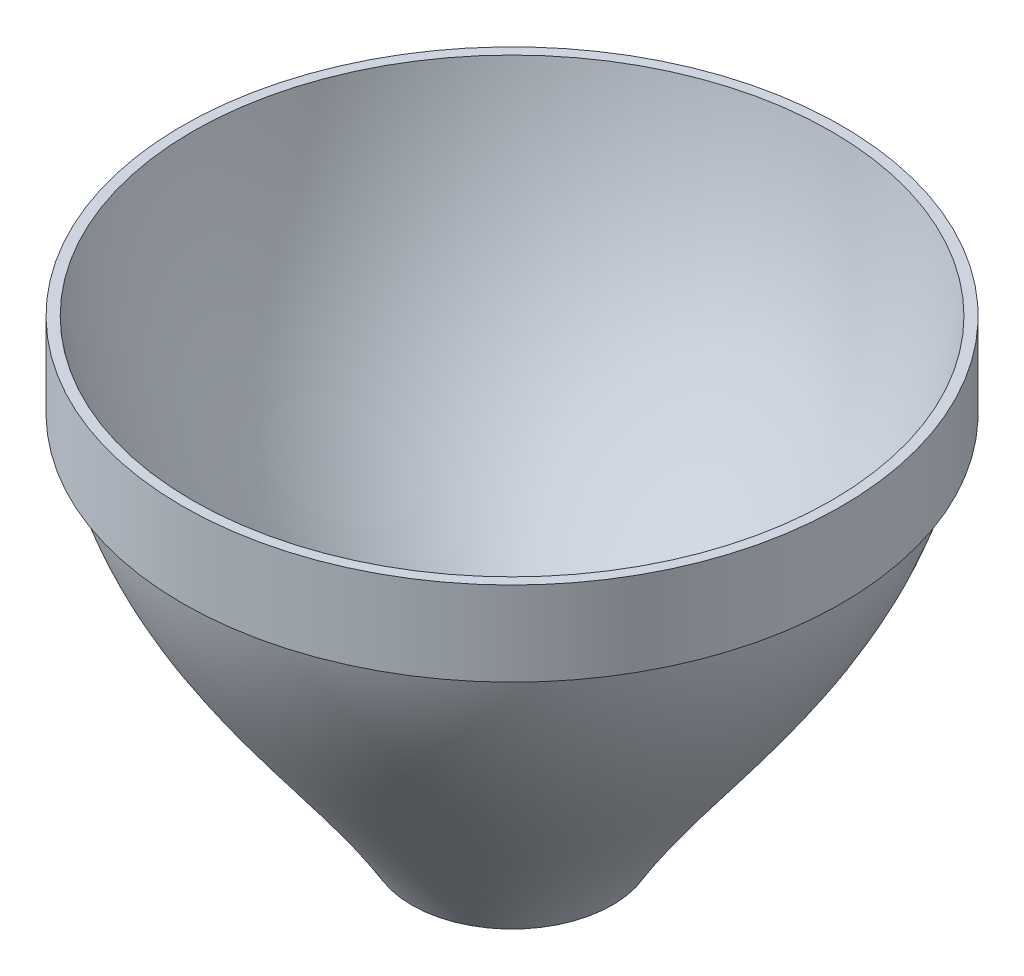
from build123d import *


with BuildPart() as part:
    # Sketch1 → Revolve1 (revolve)
    with BuildSketch(Plane.XY):
        with BuildLine():
            Line((16.834212464, 99.187404963), (18.834212464, 99.187404963))
            add(Edge.make_bspline(
                [(-0.646399178, 135.875470661), (2.395084428, 117.282668717), (12.010439891, 111.551891656), (18.834212464, 99.187404963)],
                knots=[0, 0, 0, 0, 1, 1, 1, 1], degree=3))
            Line((-0.646399178, 135.875470661), (-1.446399178, 135.875470661))
            Line((-1.446399178, 135.875470661), (-1.446399178, 129.16547318))
            Line((-1.446399178, 129.16547318), (-0.646399178, 129.16547318))
            add(Edge.make_bspline(
                [(-0.646399178, 129.16547318), (-0.498064269, 128.410111508), (-0.137212776, 126.904134616), (0.794833985, 124.011476755), (2.923643825, 119.180648182), (6.182754984, 114.134580568), (9.687971434, 109.382734746), (12.299759057, 105.924914676), (14.341960115, 103.104646049), (15.831320414, 100.858575863), (16.506671564, 99.753390571), (16.834212464, 99.187404963)],
                knots=[0.117144833, 0.117144833, 0.117144833, 0.117144833, 0.169312009, 0.221479185, 0.325813538, 0.534482242, 0.638816594, 0.743150946, 0.847485298, 0.899652474, 0.95181965, 0.95181965, 0.95181965, 0.95181965], degree=3))
        make_face()
    revolve(axis=Axis((24.834212464, 148.471380655, 0), (0, -1, 0)))


solid = part.part
